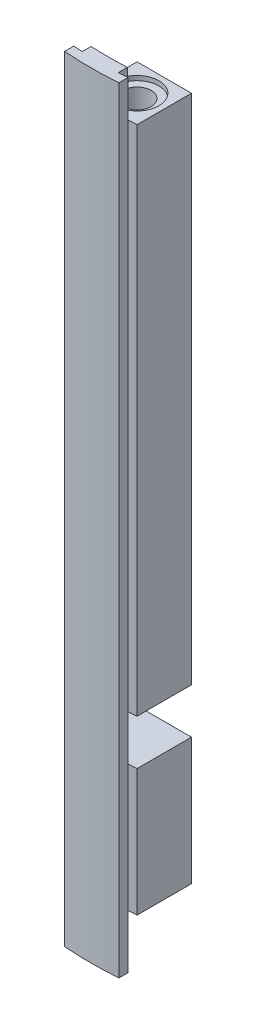
from build123d import *

# Parameters (mm, degrees)
BOSS_EXTRUDE2_DEPTH = 75.5
BOSS_EXTRUDE3_DEPTH = 85.5
SKETCH7_W           = 37.5
SKETCH7_H           = 5
SKETCH9_R           = 1.55
CUT_EXTRUDE4_DEPTH  = 4.3
SKETCH10_R          = 2.4
CUT_EXTRUDE5_DEPTH  = 0.5
SKETCH13_R          = 2.4
CUT_EXTRUDE6_DEPTH  = 0.5
SKETCH14_R          = 1.55
CUT_EXTRUDE7_DEPTH  = 4.3


with BuildPart() as part:
    # Sketch3 → Boss-Extrude2 (new body)
    with BuildSketch(Plane.XZ.offset(5)):
        with BuildLine():
            Line((-3, 37.379807383), (-3, 31.379807383))
            Line((-3, 31.379807383), (3, 31.379807383))
            Line((3, 31.379807383), (3, 37.379807383))
            ThreePointArc((3, 37.379807383), (0, 37.5), (-3, 37.379807383))
        make_face()
    extrude(amount=BOSS_EXTRUDE2_DEPTH)

    # Sketch5 → Boss-Extrude3 (add)
    with BuildSketch(Plane(origin=(0, 0, 0), x_dir=(1, 0, 0), z_dir=(0, 1, 0))):
        with BuildLine():
            Line((-2.99999884, -38.360165319), (-2.99999884, -39.385911275))
            ThreePointArc((-2.99999884, -39.385911275), (1.163e-06, -39.5), (3.00000116, -39.385911098))
            Line((3.00000116, -39.385911098), (3.00000116, -38.381035126))
            ThreePointArc((3.00000116, -38.381035126), (2.500212929, -38.41682964), (2.00000116, -38.446116314))
            Line((2.00000116, -38.446116314), (2.00000116, -37.446628625))
            ThreePointArc((2.00000116, -37.446628625), (0, -37.5), (-2.00000116, -37.446628625))
            Line((-2.00000116, -37.446628625), (-2.00000116, -38.425281674))
            ThreePointArc((-2.00000116, -38.425281674), (-2.500211998, -38.395979168), (-2.99999884, -38.360165319))
        make_face()
    extrude(amount=-BOSS_EXTRUDE3_DEPTH)

    # Sketch7 → Cut-Revolve1 (revolve, cut)
    with BuildSketch(Plane(origin=(0, 0, 0), x_dir=(0, 0, -1), z_dir=(1, 0, 0))):
        with Locations((-18.75, -64)):
            Rectangle(SKETCH7_W, SKETCH7_H)
    revolve(axis=Axis((0, -27.016689378, 0), (0, -1, 0)), mode=Mode.SUBTRACT)

    # Sketch9 → Cut-Extrude4 (cut)
    with BuildSketch(Plane(origin=(0, -80.5, 0), x_dir=(-1, 0, 0), z_dir=(0, -1, 0))):
        with Locations((0, -34.420864201)):
            Circle(SKETCH9_R)
    extrude(amount=-CUT_EXTRUDE4_DEPTH, mode=Mode.SUBTRACT)

    # Sketch10 → Cut-Extrude5 (cut)
    with BuildSketch(Plane(origin=(0, -80.5, 0), x_dir=(-1, 0, 0), z_dir=(0, -1, 0))):
        with Locations((0, -34.420864201)):
            Circle(SKETCH10_R)
    extrude(amount=-CUT_EXTRUDE5_DEPTH, mode=Mode.SUBTRACT)

    # Sketch13 → Cut-Extrude6 (cut)
    with BuildSketch(Plane(origin=(0, -5, 0), x_dir=(-1, 0, 0), z_dir=(0, -1, 0))):
        with Locations((0, -34.379807383)):
            Circle(SKETCH13_R)
    extrude(amount=CUT_EXTRUDE6_DEPTH, mode=Mode.SUBTRACT)

    # Sketch14 → Cut-Extrude7 (cut)
    with BuildSketch(Plane(origin=(0, -5, 0), x_dir=(-1, 0, 0), z_dir=(0, -1, 0))):
        with Locations((0, -34.379807383)):
            Circle(SKETCH14_R)
    extrude(amount=CUT_EXTRUDE7_DEPTH, mode=Mode.SUBTRACT)


solid = part.part
